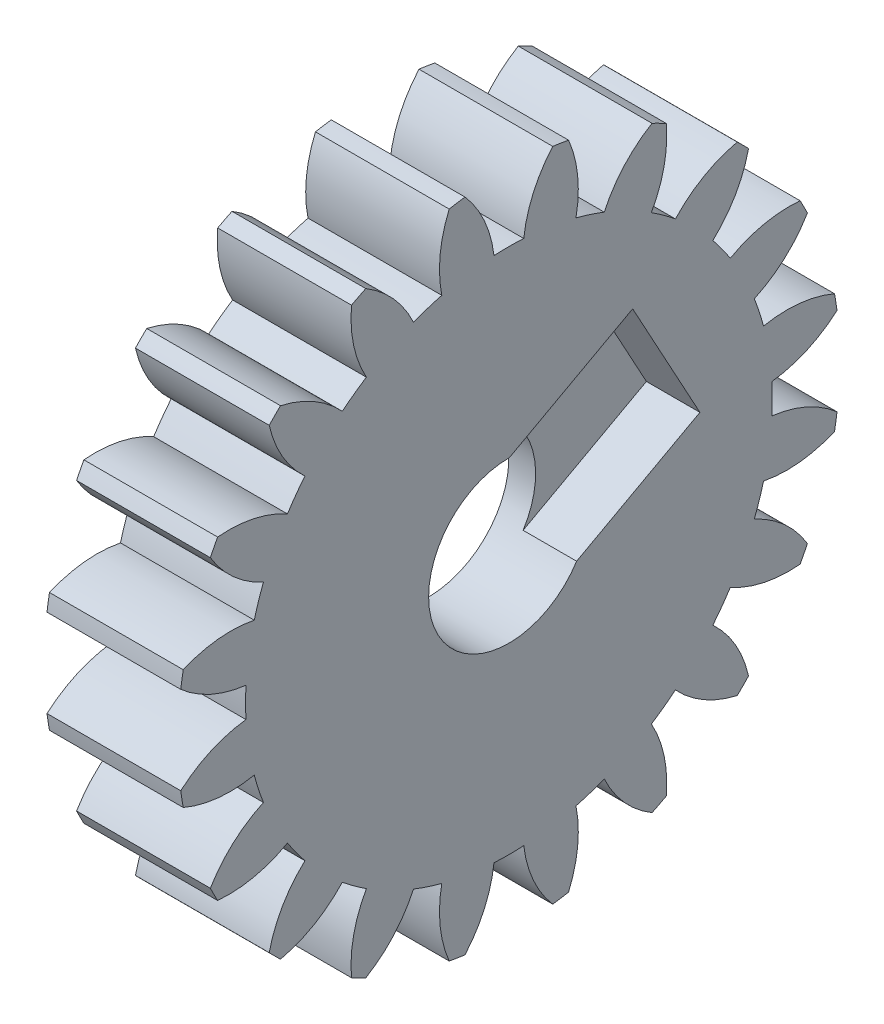
from build123d import *

# Parameters (mm, degrees)
BASPROSKE_W        = 10
BASPROSKE_H        = 24.75
TOOTHCUT_DEPTH     = 37.402266413
TEETHCUTS_COUNT    = 20
BORSKE_R           = 6
BORE_DEPTH         = 50.0000508
CUT_EXTRUDE1_DEPTH = 4
CUT_EXTRUDE2_DEPTH = 4


with BuildPart() as part:
    # BasProSke → Base-Revolve (revolve)
    with BuildSketch(Plane(origin=(0, 0, 0), x_dir=(1, 0, 0), z_dir=(0, 1, 0))):
        with Locations((5, 12.375)):
            Rectangle(BASPROSKE_W, BASPROSKE_H)
    revolve(axis=Axis((-10, 0, 0), (1, 0, 0)))

    # TooCutSke → ToothCut (cut, through all)
    with BuildSketch(Plane(origin=(0, 0, 0), x_dir=(0, 0, -1), z_dir=(1, 0, 0))):
        with BuildLine():
            ThreePointArc((1.111948432, 19.655071939), (0, 19.6865), (-1.111948432, 19.655071939))
            ThreePointArc((-1.111948432, 19.655071939), (-1.832349961, 22.271720111), (-3.300041734, 24.55463642))
            ThreePointArc((-3.300041734, 24.55463642), (0, 24.7754), (3.300041734, 24.55463642))
            ThreePointArc((3.300041734, 24.55463642), (1.832349961, 22.271720111), (1.111948432, 19.655071939))
        make_face()
    toothcut = extrude(amount=TOOTHCUT_DEPTH, mode=Mode.SUBTRACT)

    # TeethCuts: ToothCut ×20 about axis
    teethcuts_axis = Axis((-10, 0, 0), (1, 0, 0))
    for i in range(1, TEETHCUTS_COUNT):
        add(toothcut.rotate(teethcuts_axis, i * 360 / TEETHCUTS_COUNT), mode=Mode.SUBTRACT)

    # BorSke → Bore (cut, symmetric)
    with BuildSketch(Plane(origin=(0, 0, 0), x_dir=(0, 0, -1), z_dir=(1, 0, 0))):
        Circle(BORSKE_R)
    extrude(amount=BORE_DEPTH, both=True, mode=Mode.SUBTRACT)

    # Sketch1 → Cut-Extrude1 (cut)
    with BuildSketch(Plane(origin=(10, 0, 0), x_dir=(0, 0, -1), z_dir=(1, 0, 0))):
        with BuildLine():
            Line((9.25360376, 11.028159645), (0.035874537, 5.999892751))
            ThreePointArc((0.035874537, 5.999892751), (-5.267273842, -2.873295368), (5.064141431, -3.217836473))
            Line((5.064141431, -3.217836473), (14.281870655, 1.810430421))
            Line((14.281870655, 1.810430421), (9.25360376, 11.028159645))
        make_face()
    extrude(amount=-CUT_EXTRUDE1_DEPTH, mode=Mode.SUBTRACT)

    # Sketch2 → Cut-Extrude2 (cut)
    with BuildSketch(Plane.ZY):
        Polygon((12.46340215, -6.055048046), (11.475526504, 7.766098857), (-0.987875646, 13.821146903), (-12.46340215, 6.055048046), (-11.475526504, -7.766098857), (0.987875646, -13.821146903), align=None)
    extrude(amount=-CUT_EXTRUDE2_DEPTH, mode=Mode.SUBTRACT)


solid = part.part
